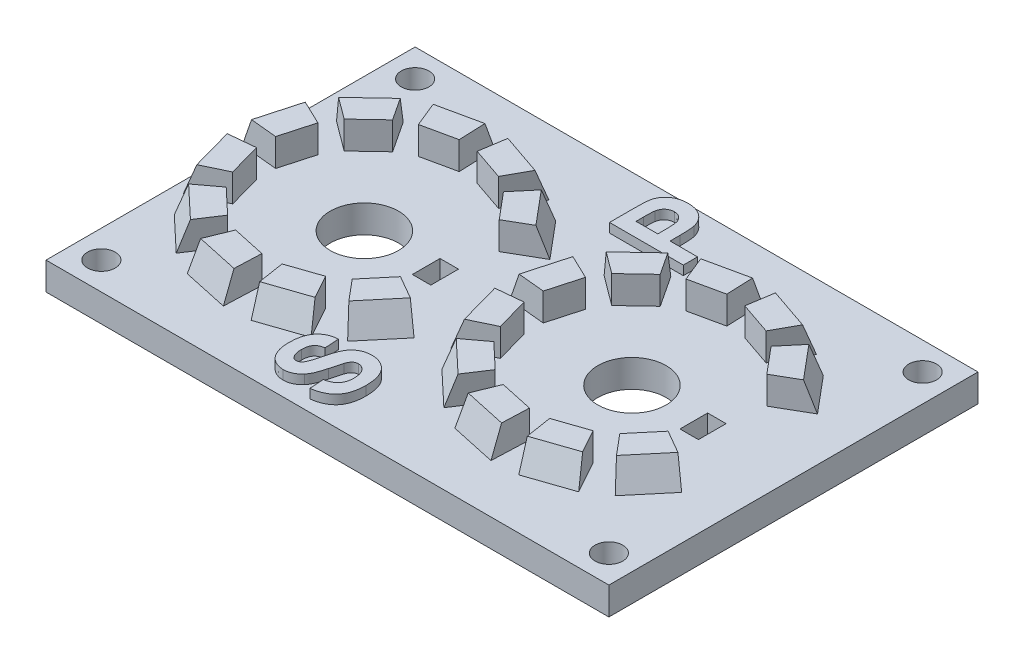
from build123d import *

# Parameters (mm, degrees)
BOSS_EXTRUDE1_DEPTH = 20
SKETCH2_W           = 55
SKETCH2_H           = 34
CUT_EXTRUDE1_DEPTH  = 17
BOSS_EXTRUDE3_REACH = 47
SKETCH7_R           = 1.5
CUT_EXTRUDE4_DEPTH  = 46
SKETCH8_R           = 43.974749051
CUT_EXTRUDE5_DEPTH  = 9
SKETCH10_R          = 55.926551309
CUT_EXTRUDE6_DEPTH  = 17
SKETCH11_R          = 3.7
SKETCH11_W          = 2
SKETCH11_H          = 3
CUT_EXTRUDE7_DEPTH  = 41.422765863
BOSS_EXTRUDE4_DEPTH = 3
CHAMFER1_SIZE       = 1.2
CHAMFER1_SIZE_2     = 3.296972903
BOSS_EXTRUDE5_DEPTH = 1


with BuildPart() as part:
    # Sketch1 → Boss-Extrude1 (new body)
    with BuildSketch(Plane(origin=(0, 0, 0), x_dir=(1, 0, 0), z_dir=(0, 1, 0))):
        with BuildLine():
            Line((35, 20), (35, 7))
            ThreePointArc((35, 7), (28, 0), (35, -7))
            Line((35, -7), (35, -20))
            Line((35, -20), (-35, -20))
            Line((-35, -20), (-35, 20))
            Line((-35, 20), (35, 20))
        make_face()
    extrude(amount=BOSS_EXTRUDE1_DEPTH)

    # Sketch2 → Cut-Extrude1 (cut)
    with BuildSketch(Plane(origin=(0, 20, 0), x_dir=(1, 0, 0), z_dir=(0, 1, 0))):
        with Locations((-4.5, 0)):
            Rectangle(SKETCH2_W, SKETCH2_H)
    extrude(amount=-CUT_EXTRUDE1_DEPTH, mode=Mode.SUBTRACT)

    # Sketch6 → Boss-Extrude3 (add, up to next)
    with BuildSketch(Plane(origin=(0, 20, 0), x_dir=(1, 0, 0), z_dir=(0, 1, 0)), mode=Mode.PRIVATE) as boss_extrude3_sk1:
        with BuildLine():
            Line((-32, -14), (-32, -17))
            Line((-32, -17), (-29, -17))
            ThreePointArc((-29, -17), (-29.878679656, -14.878679656), (-32, -14))
        make_face()
    boss_extrude3_tool1 = extrude(boss_extrude3_sk1.sketch, amount=-BOSS_EXTRUDE3_REACH, mode=Mode.PRIVATE) - part.part
    # Sketch6 → Boss-Extrude3 (add, up to next)
    with BuildSketch(Plane(origin=(0, 20, 0), x_dir=(1, 0, 0), z_dir=(0, 1, 0)), mode=Mode.PRIVATE) as boss_extrude3_sk2:
        with BuildLine():
            Line((23, -14), (23, -17))
            Line((23, -17), (20, -17))
            ThreePointArc((20, -17), (20.878679656, -14.878679656), (23, -14))
        make_face()
    boss_extrude3_tool2 = extrude(boss_extrude3_sk2.sketch, amount=-BOSS_EXTRUDE3_REACH, mode=Mode.PRIVATE) - part.part
    # Sketch6 → Boss-Extrude3 (add, up to next)
    with BuildSketch(Plane(origin=(0, 20, 0), x_dir=(1, 0, 0), z_dir=(0, 1, 0)), mode=Mode.PRIVATE) as boss_extrude3_sk3:
        with BuildLine():
            Line((20, 17), (23, 17))
            Line((23, 17), (23, 14))
            ThreePointArc((23, 14), (20.878679656, 14.878679656), (20, 17))
        make_face()
    boss_extrude3_tool3 = extrude(boss_extrude3_sk3.sketch, amount=-BOSS_EXTRUDE3_REACH, mode=Mode.PRIVATE) - part.part
    # Sketch6 → Boss-Extrude3 (add, up to next)
    with BuildSketch(Plane(origin=(0, 20, 0), x_dir=(1, 0, 0), z_dir=(0, 1, 0)), mode=Mode.PRIVATE) as boss_extrude3_sk4:
        with BuildLine():
            Line((-32, 14), (-32, 17))
            Line((-32, 17), (-29, 17))
            ThreePointArc((-29, 17), (-29.878679656, 14.878679656), (-32, 14))
        make_face()
    boss_extrude3_tool4 = extrude(boss_extrude3_sk4.sketch, amount=-BOSS_EXTRUDE3_REACH, mode=Mode.PRIVATE) - part.part
    add(boss_extrude3_tool1.solids().sort_by_distance((-30.72676, 20, 15.72676))[0])
    add(boss_extrude3_tool2.solids().sort_by_distance((21.72676, 20, 15.72676))[0])
    add(boss_extrude3_tool3.solids().sort_by_distance((21.72676, 20, -15.72676))[0])
    add(boss_extrude3_tool4.solids().sort_by_distance((-30.72676, 20, -15.72676))[0])

    # Sketch7 → Cut-Extrude4 (cut, through all)
    with BuildSketch(Plane(origin=(0, 20, 0), x_dir=(1, 0, 0), z_dir=(0, 1, 0))):
        with Locations(Location((-32, 17, 0), (0, 0, 270))):
            Circle(SKETCH7_R)
        with Locations(Location((23, 17, 0), (0, 0, 270))):
            Circle(SKETCH7_R)
        with Locations(Location((23, -17, 0), (0, 0, 270))):
            Circle(SKETCH7_R)
        with Locations(Location((-32, -17, 0), (0, 0, 270))):
            Circle(SKETCH7_R)
    extrude(amount=-CUT_EXTRUDE4_DEPTH, mode=Mode.SUBTRACT)

    # Sketch8 → Cut-Extrude5 (cut)
    with BuildSketch(Plane(origin=(35, 0, 0), x_dir=(0, 0, -1), z_dir=(1, 0, 0))):
        Circle(SKETCH8_R)
    extrude(amount=-CUT_EXTRUDE5_DEPTH, mode=Mode.SUBTRACT)

    # Sketch10 → Cut-Extrude6 (cut)
    with BuildSketch(Plane(origin=(0, 20, 0), x_dir=(1, 0, 0), z_dir=(0, 1, 0))):
        Circle(SKETCH10_R)
    extrude(amount=-CUT_EXTRUDE6_DEPTH, mode=Mode.SUBTRACT)

    # Sketch11 → Cut-Extrude7 (cut, through all)
    with BuildSketch(Plane(origin=(0, 3, 0), x_dir=(1, 0, 0), z_dir=(0, 1, 0))):
        with Locations(Location((8.5, 0, 0), (0, 0, 270))):
            Circle(SKETCH11_R)
        with Locations(Location((-20.5, 0, 0), (0, 0, 270))):
            Circle(SKETCH11_R)
        with Locations((-12.8, 0)):
            Rectangle(SKETCH11_W, SKETCH11_H)
        with Locations((16.2, 0)):
            Rectangle(SKETCH11_W, SKETCH11_H)
    extrude(amount=-CUT_EXTRUDE7_DEPTH, mode=Mode.SUBTRACT)

    # Sketch13 → Boss-Extrude4 (add)
    with BuildSketch(Plane(origin=(0, 3, 0), x_dir=(1, 0, 0), z_dir=(0, 1, 0))):
        Polygon((20.191342951, -6.75), (17.76647182, -5.35), (15.377827424, -8.196675541), (17.177632731, -10.341599982), align=None)
        Polygon((10.153351083, -10.571491389), (10.586003703, -13.337862968), (15.022020091, -11.820036123), (13.669304812, -9.368473075), align=None)
        Polygon((4.453261518, -9.905246471), (3.394301915, -12.497273585), (7.976532488, -13.489847359), (8.085103528, -10.691953092), align=None)
        Polygon((-0.082718162, -6.389596931), (-2.328663102, -8.061640988), (1.081628796, -11.279085454), (2.620253935, -8.939719582), align=None)
        Polygon((-2.149739915, -1.035876317), (-4.936587743, -1.306946754), (-3.679260235, -5.823711887), (-1.153191445, -4.615830903), align=None)
        Polygon((-1.153191445, 4.615830903), (-3.679260235, 5.823711887), (-4.936587743, 1.306946754), (-2.149739915, 1.035876317), align=None)
        Polygon((2.620253935, 8.939719582), (1.081628796, 11.279085454), (-2.328663102, 8.061640988), (-0.082718162, 6.389596931), align=None)
        Polygon((8.085103528, 10.691953092), (7.976532488, 13.489847359), (3.394301915, 12.497273585), (4.453261518, 9.905246471), align=None)
        Polygon((13.669304812, 9.368473075), (15.022020091, 11.820036123), (10.586003703, 13.337862968), (10.153351083, 10.571491389), align=None)
        Polygon((17.76647182, 5.35), (20.191342951, 6.75), (17.177632731, 10.341599982), (15.377827424, 8.196675541), align=None)
        Polygon((-13.622172576, -8.196675541), (-11.822367269, -10.341599982), (-8.808657049, -6.75), (-11.23352818, -5.35), align=None)
        Polygon((-15.330695188, -9.368473075), (-18.846648917, -10.571491389), (-18.413996297, -13.337862968), (-13.977979909, -11.820036123), align=None)
        Polygon((-20.914896472, -10.691953092), (-24.546738482, -9.905246471), (-25.605698085, -12.497273585), (-21.023467512, -13.489847359), align=None)
        Polygon((-26.379746065, -8.939719582), (-29.082718162, -6.389596931), (-31.328663102, -8.061640988), (-27.918371204, -11.279085454), align=None)
        Polygon((-30.153191445, -4.615830903), (-31.149739915, -1.035876317), (-33.936587743, -1.306946754), (-32.679260235, -5.823711887), align=None)
        Polygon((-31.149739915, 1.035876317), (-30.153191445, 4.615830903), (-32.679260235, 5.823711887), (-33.936587743, 1.306946754), align=None)
        Polygon((-29.082718162, 6.389596931), (-26.379746065, 8.939719582), (-27.918371204, 11.279085454), (-31.328663102, 8.061640988), align=None)
        Polygon((-24.546738482, 9.905246471), (-20.914896472, 10.691953092), (-21.023467512, 13.489847359), (-25.605698085, 12.497273585), align=None)
        Polygon((-18.846648917, 10.571491389), (-15.330695188, 9.368473075), (-13.977979909, 11.820036123), (-18.413996297, 13.337862968), align=None)
        Polygon((-13.622172576, 8.196675541), (-11.23352818, 5.35), (-8.808657049, 6.75), (-11.822367269, 10.341599982), align=None)
    extrude(amount=BOSS_EXTRUDE4_DEPTH)

    # Chamfer1
    # the kernel refuses this chamfer: 3.296972903, 1.2 mm, written as the material it adds along each edge
    with BuildSketch(Plane(origin=(25.689098781, 3, -0.198029738), x_dir=(0.7622780808055234, -0.09904090225205052, -0.6396272564584374), z_dir=(-0.6427876096865381, 0, -0.7660444431189791))) as chamfer1_piece_1_section:
        Polygon((CHAMFER1_SIZE * 0.995083363182, -CHAMFER1_SIZE * 0.0990409022521), (-CHAMFER1_SIZE_2 * 0.0990409022624, -CHAMFER1_SIZE_2 * 0.995083363286), (0, 0), align=None)
    chamfer1_piece_1 = extrude(amount=21.794480275, mode=Mode.PRIVATE)
    chamfer1_piece_1 = split(chamfer1_piece_1, bisect_by=Plane(origin=(20.168043267, 4.0676523, -6.736547921), z_dir=(-0.5000000000000017, 0, -0.8660254037844379)), keep=Keep.TOP, mode=Mode.PRIVATE)
    chamfer1_piece_1 = split(chamfer1_piece_1, bisect_by=Plane(origin=(17.160339072, 4.0676523, -10.320990202), z_dir=(0.7660444431189775, 0, 0.6427876096865401)), keep=Keep.TOP, mode=Mode.PRIVATE)
    chamfer1_piece_1 = split(chamfer1_piece_1, bisect_by=Plane(origin=(18.980208112, 6, -8.793938761), z_dir=(0, -1, 0)), keep=Keep.TOP, mode=Mode.PRIVATE)
    add(chamfer1_piece_1)
    with BuildSketch(Plane(origin=(23.114415568, 3, -9.051143038), x_dir=(0.32214225983948014, -0.09904090225205053, -0.9414962900121342), z_dir=(-0.9461481568757503, 0, -0.3237339420583218))) as chamfer1_piece_2_section:
        Polygon((CHAMFER1_SIZE * 0.995083363182, -CHAMFER1_SIZE * 0.0990409022521), (-CHAMFER1_SIZE_2 * 0.0990409022624, -CHAMFER1_SIZE_2 * 0.995083363286), (0, 0), align=None)
    chamfer1_piece_2 = extrude(amount=21.794480275, mode=Mode.PRIVATE)
    chamfer1_piece_2 = split(chamfer1_piece_2, bisect_by=Plane(origin=(15.009022353, 4.0676523, -11.796479966), z_dir=(-0.87555823130209, 0, -0.48311259929664013)), keep=Keep.TOP, mode=Mode.PRIVATE)
    chamfer1_piece_2 = split(chamfer1_piece_2, bisect_by=Plane(origin=(10.581846505, 4.0676523, -13.311281933), z_dir=(0.987989849476809, 0, 0.15451879280784037)), keep=Keep.TOP, mode=Mode.PRIVATE)
    chamfer1_piece_2 = split(chamfer1_piece_2, bisect_by=Plane(origin=(12.928984658, 6, -12.944196225), z_dir=(0, -1, 0)), keep=Keep.TOP, mode=Mode.PRIVATE)
    add(chamfer1_piece_2)
    with BuildSketch(Plane(origin=(16.335658949, 3, -15.300548406), x_dir=(-0.2106630011766402, -0.09904090225205076, -0.972528662619437), z_dir=(-0.9773338582506358, 0, 0.21170387222940967))) as chamfer1_piece_3_section:
        Polygon((CHAMFER1_SIZE * 0.995083363182, -CHAMFER1_SIZE * 0.0990409022521), (-CHAMFER1_SIZE_2 * 0.0990409022624, -CHAMFER1_SIZE_2 * 0.995083363286), (0, 0), align=None)
    chamfer1_piece_3 = extrude(amount=21.794480275, mode=Mode.PRIVATE)
    chamfer1_piece_3 = split(chamfer1_piece_3, bisect_by=Plane(origin=(7.977575707, 4.0676523, -13.462963434), z_dir=(-0.9992479525042302, 0, 0.03877537125681469)), keep=Keep.TOP, mode=Mode.PRIVATE)
    chamfer1_piece_3 = split(chamfer1_piece_3, bisect_by=Plane(origin=(3.404477063, 4.0676523, -12.472367761), z_dir=(0.9257239692688908, 0, -0.37819985817164176)), keep=Keep.TOP, mode=Mode.PRIVATE)
    chamfer1_piece_3 = split(chamfer1_piece_3, bisect_by=Plane(origin=(5.603692013, 6, -13.370845936), z_dir=(0, -1, 0)), keep=Keep.TOP, mode=Mode.PRIVATE)
    add(chamfer1_piece_3)
    with BuildSketch(Plane(origin=(7.302848089, 3, -17.148503141), x_dir=(-0.6828676369657709, -0.09904090225205052, -0.723797409546265), z_dir=(-0.7273736415730487, 0, 0.6862416378687335))) as chamfer1_piece_4_section:
        Polygon((CHAMFER1_SIZE * 0.995083363182, -CHAMFER1_SIZE * 0.0990409022521), (-CHAMFER1_SIZE_2 * 0.0990409022624, -CHAMFER1_SIZE_2 * 0.995083363286), (0, 0), align=None)
    chamfer1_piece_4 = extrude(amount=21.794480275, mode=Mode.PRIVATE)
    chamfer1_piece_4 = split(chamfer1_piece_4, bisect_by=Plane(origin=(1.096412872, 4.0676523, -11.256607358), z_dir=(-0.8354878114129372, 0, 0.5495089780708051)), keep=Keep.TOP, mode=Mode.PRIVATE)
    chamfer1_piece_4 = split(chamfer1_piece_4, bisect_by=Plane(origin=(-2.307082653, 4.0676523, -8.045574939), z_dir=(0.597158591702786, 0, -0.8021231927550441)), keep=Keep.TOP, mode=Mode.PRIVATE)
    chamfer1_piece_4 = split(chamfer1_piece_4, bisect_by=Plane(origin=(-0.888430716, 6, -9.951155194), z_dir=(0, -1, 0)), keep=Keep.TOP, mode=Mode.PRIVATE)
    add(chamfer1_piece_4)
    with BuildSketch(Plane(origin=(-1.385582629, 3, -14.063413127), x_dir=(-0.9586343338844463, -0.09904090225205059, -0.26685410541909116), z_dir=(-0.2681726127606368, 0, 0.9633708786158806))) as chamfer1_piece_5_section:
        Polygon((CHAMFER1_SIZE * 0.995083363182, -CHAMFER1_SIZE * 0.0990409022521), (-CHAMFER1_SIZE_2 * 0.0990409022624, -CHAMFER1_SIZE_2 * 0.995083363286), (0, 0), align=None)
    chamfer1_piece_5 = extrude(amount=21.794480275, mode=Mode.PRIVATE)
    chamfer1_piece_5 = split(chamfer1_piece_5, bisect_by=Plane(origin=(-3.65498818, 4.0676523, -5.812105808), z_dir=(-0.4313860656812545, 0, 0.9021674247810373)), keep=Keep.TOP, mode=Mode.PRIVATE)
    chamfer1_piece_5 = split(chamfer1_piece_5, bisect_by=Plane(origin=(-4.90980996, 4.0676523, -1.30434214), z_dir=(0.09681087070317776, 0, -0.995302795793166)), keep=Keep.TOP, mode=Mode.PRIVATE)
    chamfer1_piece_5 = split(chamfer1_piece_5, bisect_by=Plane(origin=(-4.679819249, 6, -3.668853442), z_dir=(0, -1, 0)), keep=Keep.TOP, mode=Mode.PRIVATE)
    add(chamfer1_piece_5)
    with BuildSketch(Plane(origin=(-7.230265348, 3, -6.932754485), x_dir=(-0.9586343338844462, -0.09904090225205059, 0.2668541054190925), z_dir=(0.2681726127606381, 0, 0.9633708786158802))) as chamfer1_piece_6_section:
        Polygon((CHAMFER1_SIZE * 0.995083363182, -CHAMFER1_SIZE * 0.0990409022521), (-CHAMFER1_SIZE_2 * 0.0990409022624, -CHAMFER1_SIZE_2 * 0.995083363286), (0, 0), align=None)
    chamfer1_piece_6 = extrude(amount=21.794480275, mode=Mode.PRIVATE)
    chamfer1_piece_6 = split(chamfer1_piece_6, bisect_by=Plane(origin=(-4.90980996, 4.0676523, 1.30434214), z_dir=(0.09681087070317865, 0, 0.9953027957931659)), keep=Keep.TOP, mode=Mode.PRIVATE)
    chamfer1_piece_6 = split(chamfer1_piece_6, bisect_by=Plane(origin=(-3.65498818, 4.0676523, 5.812105808), z_dir=(-0.4313860656812539, 0, -0.9021674247810375)), keep=Keep.TOP, mode=Mode.PRIVATE)
    chamfer1_piece_6 = split(chamfer1_piece_6, bisect_by=Plane(origin=(-4.679819249, 6, 3.668853442), z_dir=(0, -1, 0)), keep=Keep.TOP, mode=Mode.PRIVATE)
    add(chamfer1_piece_6)
    with BuildSketch(Plane(origin=(-8.549882395, 3, 2.192223301), x_dir=(-0.6828676369657699, -0.09904090225205057, 0.723797409546266), z_dir=(0.7273736415730497, 0, 0.6862416378687326))) as chamfer1_piece_7_section:
        Polygon((CHAMFER1_SIZE * 0.995083363182, -CHAMFER1_SIZE * 0.0990409022521), (-CHAMFER1_SIZE_2 * 0.0990409022624, -CHAMFER1_SIZE_2 * 0.995083363286), (0, 0), align=None)
    chamfer1_piece_7 = extrude(amount=21.794480275, mode=Mode.PRIVATE)
    chamfer1_piece_7 = split(chamfer1_piece_7, bisect_by=Plane(origin=(-2.307082653, 4.0676523, 8.045574939), z_dir=(0.5971585917027863, 0, 0.802123192755044)), keep=Keep.TOP, mode=Mode.PRIVATE)
    chamfer1_piece_7 = split(chamfer1_piece_7, bisect_by=Plane(origin=(1.096412872, 4.0676523, 11.256607358), z_dir=(-0.8354878114129369, 0, -0.5495089780708055)), keep=Keep.TOP, mode=Mode.PRIVATE)
    chamfer1_piece_7 = split(chamfer1_piece_7, bisect_by=Plane(origin=(-0.888430716, 6, 9.951155194), z_dir=(0, -1, 0)), keep=Keep.TOP, mode=Mode.PRIVATE)
    add(chamfer1_piece_7)
    with BuildSketch(Plane(origin=(-4.964824547, 3, 10.686572538), x_dir=(-0.21066300117663903, -0.09904090225205053, 0.9725286626194373), z_dir=(0.977333858250636, 0, 0.21170387222940854))) as chamfer1_piece_8_section:
        Polygon((CHAMFER1_SIZE * 0.995083363182, -CHAMFER1_SIZE * 0.0990409022521), (-CHAMFER1_SIZE_2 * 0.0990409022624, -CHAMFER1_SIZE_2 * 0.995083363286), (0, 0), align=None)
    chamfer1_piece_8 = extrude(amount=21.794480275, mode=Mode.PRIVATE)
    chamfer1_piece_8 = split(chamfer1_piece_8, bisect_by=Plane(origin=(3.404477063, 4.0676523, 12.472367761), z_dir=(0.9257239692688906, 0, 0.3781998581716422)), keep=Keep.TOP, mode=Mode.PRIVATE)
    chamfer1_piece_8 = split(chamfer1_piece_8, bisect_by=Plane(origin=(7.977575707, 4.0676523, 13.462963434), z_dir=(-0.9992479525042302, 0, -0.03877537125681596)), keep=Keep.TOP, mode=Mode.PRIVATE)
    chamfer1_piece_8 = split(chamfer1_piece_8, bisect_by=Plane(origin=(5.603692013, 6, 13.370845936), z_dir=(0, -1, 0)), keep=Keep.TOP, mode=Mode.PRIVATE)
    add(chamfer1_piece_8)
    with BuildSketch(Plane(origin=(2.493608225, 3, 16.106756053), x_dir=(0.3221422598394811, -0.0990409022520505, 0.9414962900121339), z_dir=(0.9461481568757498, 0, -0.3237339420583227))) as chamfer1_piece_9_section:
        Polygon((CHAMFER1_SIZE * 0.995083363182, -CHAMFER1_SIZE * 0.0990409022521), (-CHAMFER1_SIZE_2 * 0.0990409022624, -CHAMFER1_SIZE_2 * 0.995083363286), (0, 0), align=None)
    chamfer1_piece_9 = extrude(amount=21.794480275, mode=Mode.PRIVATE)
    chamfer1_piece_9 = split(chamfer1_piece_9, bisect_by=Plane(origin=(10.581846505, 4.0676523, 13.311281933), z_dir=(0.9879898494768089, 0, -0.15451879280784117)), keep=Keep.TOP, mode=Mode.PRIVATE)
    chamfer1_piece_9 = split(chamfer1_piece_9, bisect_by=Plane(origin=(15.009022353, 4.0676523, 11.796479966), z_dir=(-0.8755582313020898, 0, 0.4831125992966406)), keep=Keep.TOP, mode=Mode.PRIVATE)
    chamfer1_piece_9 = split(chamfer1_piece_9, bisect_by=Plane(origin=(12.928984658, 6, 12.944196225), z_dir=(0, -1, 0)), keep=Keep.TOP, mode=Mode.PRIVATE)
    add(chamfer1_piece_9)
    with BuildSketch(Plane(origin=(11.679876901, 3, 16.893570244), x_dir=(0.7622780808055257, -0.09904090225205066, 0.6396272564584348), z_dir=(0.6427876096865355, 0, -0.7660444431189813))) as chamfer1_piece_10_section:
        Polygon((CHAMFER1_SIZE * 0.995083363182, -CHAMFER1_SIZE * 0.0990409022521), (-CHAMFER1_SIZE_2 * 0.0990409022624, -CHAMFER1_SIZE_2 * 0.995083363286), (0, 0), align=None)
    chamfer1_piece_10 = extrude(amount=21.794480275, mode=Mode.PRIVATE)
    chamfer1_piece_10 = split(chamfer1_piece_10, bisect_by=Plane(origin=(20.168043267, 4.0676523, 6.736547921), z_dir=(-0.49999999999999634, 0, 0.8660254037844408)), keep=Keep.TOP, mode=Mode.PRIVATE)
    chamfer1_piece_10 = split(chamfer1_piece_10, bisect_by=Plane(origin=(17.160339072, 4.0676523, 10.320990202), z_dir=(0.7660444431189756, 0, -0.6427876096865424)), keep=Keep.TOP, mode=Mode.PRIVATE)
    chamfer1_piece_10 = split(chamfer1_piece_10, bisect_by=Plane(origin=(18.980208112, 6, 8.793938761), z_dir=(0, -1, 0)), keep=Keep.TOP, mode=Mode.PRIVATE)
    add(chamfer1_piece_10)
    with BuildSketch(Plane(origin=(-3.310901219, 3, -0.198029738), x_dir=(0.7622780808055204, -0.09904090225205057, -0.6396272564584411), z_dir=(-0.6427876096865418, 0, -0.7660444431189761))) as chamfer1_piece_11_section:
        Polygon((CHAMFER1_SIZE * 0.995083363182, -CHAMFER1_SIZE * 0.0990409022521), (-CHAMFER1_SIZE_2 * 0.0990409022624, -CHAMFER1_SIZE_2 * 0.995083363286), (0, 0), align=None)
    chamfer1_piece_11 = extrude(amount=21.794480275, mode=Mode.PRIVATE)
    chamfer1_piece_11 = split(chamfer1_piece_11, bisect_by=Plane(origin=(-8.831956733, 4.0676523, -6.736547921), z_dir=(-0.5000000000000007, 0, -0.8660254037844383)), keep=Keep.TOP, mode=Mode.PRIVATE)
    chamfer1_piece_11 = split(chamfer1_piece_11, bisect_by=Plane(origin=(-11.839660928, 4.0676523, -10.320990202), z_dir=(0.7660444431189806, 0, 0.6427876096865364)), keep=Keep.TOP, mode=Mode.PRIVATE)
    chamfer1_piece_11 = split(chamfer1_piece_11, bisect_by=Plane(origin=(-10.019791888, 6, -8.793938761), z_dir=(0, -1, 0)), keep=Keep.TOP, mode=Mode.PRIVATE)
    add(chamfer1_piece_11)
    with BuildSketch(Plane(origin=(-5.885584432, 3, -9.051143038), x_dir=(0.3221422598394766, -0.09904090225205063, -0.9414962900121354), z_dir=(-0.9461481568757514, 0, -0.32373394205831824))) as chamfer1_piece_12_section:
        Polygon((CHAMFER1_SIZE * 0.995083363182, -CHAMFER1_SIZE * 0.0990409022521), (-CHAMFER1_SIZE_2 * 0.0990409022624, -CHAMFER1_SIZE_2 * 0.995083363286), (0, 0), align=None)
    chamfer1_piece_12 = extrude(amount=21.794480275, mode=Mode.PRIVATE)
    chamfer1_piece_12 = split(chamfer1_piece_12, bisect_by=Plane(origin=(-13.990977647, 4.0676523, -11.796479966), z_dir=(-0.8755582313020934, 0, -0.4831125992966339)), keep=Keep.TOP, mode=Mode.PRIVATE)
    chamfer1_piece_12 = split(chamfer1_piece_12, bisect_by=Plane(origin=(-18.418153495, 4.0676523, -13.311281933), z_dir=(0.9879898494768093, 0, 0.1545187928078383)), keep=Keep.TOP, mode=Mode.PRIVATE)
    chamfer1_piece_12 = split(chamfer1_piece_12, bisect_by=Plane(origin=(-16.071015342, 6, -12.944196225), z_dir=(0, -1, 0)), keep=Keep.TOP, mode=Mode.PRIVATE)
    add(chamfer1_piece_12)
    with BuildSketch(Plane(origin=(-12.664341051, 3, -15.300548406), x_dir=(-0.21066300117664277, -0.09904090225205073, -0.9725286626194363), z_dir=(-0.9773338582506352, 0, 0.2117038722294123))) as chamfer1_piece_13_section:
        Polygon((CHAMFER1_SIZE * 0.995083363182, -CHAMFER1_SIZE * 0.0990409022521), (-CHAMFER1_SIZE_2 * 0.0990409022624, -CHAMFER1_SIZE_2 * 0.995083363286), (0, 0), align=None)
    chamfer1_piece_13 = extrude(amount=21.794480275, mode=Mode.PRIVATE)
    chamfer1_piece_13 = split(chamfer1_piece_13, bisect_by=Plane(origin=(-21.022424293, 4.0676523, -13.462963434), z_dir=(-0.99924795250423, 0, 0.038775371256818444)), keep=Keep.TOP, mode=Mode.PRIVATE)
    chamfer1_piece_13 = split(chamfer1_piece_13, bisect_by=Plane(origin=(-25.595522937, 4.0676523, -12.472367761), z_dir=(0.9257239692688896, 0, -0.37819985817164453)), keep=Keep.TOP, mode=Mode.PRIVATE)
    chamfer1_piece_13 = split(chamfer1_piece_13, bisect_by=Plane(origin=(-23.396307987, 6, -13.370845936), z_dir=(0, -1, 0)), keep=Keep.TOP, mode=Mode.PRIVATE)
    add(chamfer1_piece_13)
    with BuildSketch(Plane(origin=(-21.697151911, 3, -17.148503141), x_dir=(-0.6828676369657719, -0.09904090225205078, -0.7237974095462643), z_dir=(-0.727373641573048, 0, 0.6862416378687345))) as chamfer1_piece_14_section:
        Polygon((CHAMFER1_SIZE * 0.995083363182, -CHAMFER1_SIZE * 0.0990409022521), (-CHAMFER1_SIZE_2 * 0.0990409022624, -CHAMFER1_SIZE_2 * 0.995083363286), (0, 0), align=None)
    chamfer1_piece_14 = extrude(amount=21.794480275, mode=Mode.PRIVATE)
    chamfer1_piece_14 = split(chamfer1_piece_14, bisect_by=Plane(origin=(-27.903587128, 4.0676523, -11.256607358), z_dir=(-0.8354878114129346, 0, 0.5495089780708089)), keep=Keep.TOP, mode=Mode.PRIVATE)
    chamfer1_piece_14 = split(chamfer1_piece_14, bisect_by=Plane(origin=(-31.307082653, 4.0676523, -8.045574939), z_dir=(0.5971585917027841, 0, -0.8021231927550454)), keep=Keep.TOP, mode=Mode.PRIVATE)
    chamfer1_piece_14 = split(chamfer1_piece_14, bisect_by=Plane(origin=(-29.888430716, 6, -9.951155194), z_dir=(0, -1, 0)), keep=Keep.TOP, mode=Mode.PRIVATE)
    add(chamfer1_piece_14)
    with BuildSketch(Plane(origin=(-30.385582629, 3, -14.063413127), x_dir=(-0.9586343338844459, -0.09904090225205042, -0.2668541054190935), z_dir=(-0.2681726127606391, 0, 0.9633708786158799))) as chamfer1_piece_15_section:
        Polygon((CHAMFER1_SIZE * 0.995083363182, -CHAMFER1_SIZE * 0.0990409022521), (-CHAMFER1_SIZE_2 * 0.0990409022624, -CHAMFER1_SIZE_2 * 0.995083363286), (0, 0), align=None)
    chamfer1_piece_15 = extrude(amount=21.794480275, mode=Mode.PRIVATE)
    chamfer1_piece_15 = split(chamfer1_piece_15, bisect_by=Plane(origin=(-35, 4.069218137, -3.671800173), z_dir=(1, 0, 0)), keep=Keep.TOP, mode=Mode.PRIVATE)
    chamfer1_piece_15 = split(chamfer1_piece_15, bisect_by=Plane(origin=(-32.654532581, 4.069218137, -5.811887956), z_dir=(-0.43138606568125154, 0, 0.9021674247810388)), keep=Keep.TOP, mode=Mode.PRIVATE)
    chamfer1_piece_15 = split(chamfer1_piece_15, bisect_by=Plane(origin=(-33.908143552, 4.069218137, -1.304180052), z_dir=(0.09681087070317723, 0, -0.995302795793166)), keep=Keep.TOP, mode=Mode.PRIVATE)
    chamfer1_piece_15 = split(chamfer1_piece_15, bisect_by=Plane(origin=(-33.677850453, 6, -3.671800173), z_dir=(0, -1, 0)), keep=Keep.TOP, mode=Mode.PRIVATE)
    add(chamfer1_piece_15)
    with BuildSketch(Plane(origin=(-36.230265348, 3, -6.932754485), x_dir=(-0.9586343338844457, -0.0990409022520507, 0.2668541054190935), z_dir=(0.2681726127606391, 0, 0.9633708786158799))) as chamfer1_piece_16_section:
        Polygon((CHAMFER1_SIZE * 0.995083363182, -CHAMFER1_SIZE * 0.0990409022521), (-CHAMFER1_SIZE_2 * 0.0990409022624, -CHAMFER1_SIZE_2 * 0.995083363286), (0, 0), align=None)
    chamfer1_piece_16 = extrude(amount=21.794480275, mode=Mode.PRIVATE)
    chamfer1_piece_16 = split(chamfer1_piece_16, bisect_by=Plane(origin=(-35, 4.069218137, 3.671800173), z_dir=(1, 0, 0)), keep=Keep.TOP, mode=Mode.PRIVATE)
    chamfer1_piece_16 = split(chamfer1_piece_16, bisect_by=Plane(origin=(-33.908143552, 4.069218137, 1.304180052), z_dir=(0.09681087070318081, 0, 0.9953027957931657)), keep=Keep.TOP, mode=Mode.PRIVATE)
    chamfer1_piece_16 = split(chamfer1_piece_16, bisect_by=Plane(origin=(-32.654532581, 4.069218137, 5.811887956), z_dir=(-0.4313860656812548, 0, -0.9021674247810371)), keep=Keep.TOP, mode=Mode.PRIVATE)
    chamfer1_piece_16 = split(chamfer1_piece_16, bisect_by=Plane(origin=(-33.677850453, 6, 3.671800173), z_dir=(0, -1, 0)), keep=Keep.TOP, mode=Mode.PRIVATE)
    add(chamfer1_piece_16)
    with BuildSketch(Plane(origin=(-37.549882395, 3, 2.192223301), x_dir=(-0.682867636965771, -0.09904090225205045, 0.7237974095462649), z_dir=(0.7273736415730486, 0, 0.6862416378687337))) as chamfer1_piece_17_section:
        Polygon((CHAMFER1_SIZE * 0.995083363182, -CHAMFER1_SIZE * 0.0990409022521), (-CHAMFER1_SIZE_2 * 0.0990409022624, -CHAMFER1_SIZE_2 * 0.995083363286), (0, 0), align=None)
    chamfer1_piece_17 = extrude(amount=21.794480275, mode=Mode.PRIVATE)
    chamfer1_piece_17 = split(chamfer1_piece_17, bisect_by=Plane(origin=(-31.307082653, 4.0676523, 8.045574939), z_dir=(0.5971585917027884, 0, 0.8021231927550422)), keep=Keep.TOP, mode=Mode.PRIVATE)
    chamfer1_piece_17 = split(chamfer1_piece_17, bisect_by=Plane(origin=(-27.903587128, 4.0676523, 11.256607358), z_dir=(-0.8354878114129358, 0, -0.549508978070807)), keep=Keep.TOP, mode=Mode.PRIVATE)
    chamfer1_piece_17 = split(chamfer1_piece_17, bisect_by=Plane(origin=(-29.888430716, 6, 9.951155194), z_dir=(0, -1, 0)), keep=Keep.TOP, mode=Mode.PRIVATE)
    add(chamfer1_piece_17)
    with BuildSketch(Plane(origin=(-33.964824547, 3, 10.686572538), x_dir=(-0.21066300117664194, -0.0990409022520504, 0.9725286626194366), z_dir=(0.9773338582506353, 0, 0.21170387222941145))) as chamfer1_piece_18_section:
        Polygon((CHAMFER1_SIZE * 0.995083363182, -CHAMFER1_SIZE * 0.0990409022521), (-CHAMFER1_SIZE_2 * 0.0990409022624, -CHAMFER1_SIZE_2 * 0.995083363286), (0, 0), align=None)
    chamfer1_piece_18 = extrude(amount=21.794480275, mode=Mode.PRIVATE)
    chamfer1_piece_18 = split(chamfer1_piece_18, bisect_by=Plane(origin=(-25.595522937, 4.0676523, 12.472367761), z_dir=(0.9257239692688904, 0, 0.37819985817164237)), keep=Keep.TOP, mode=Mode.PRIVATE)
    chamfer1_piece_18 = split(chamfer1_piece_18, bisect_by=Plane(origin=(-21.022424293, 4.0676523, 13.462963434), z_dir=(-0.99924795250423, 0, -0.0387753712568171)), keep=Keep.TOP, mode=Mode.PRIVATE)
    chamfer1_piece_18 = split(chamfer1_piece_18, bisect_by=Plane(origin=(-23.396307987, 6, 13.370845936), z_dir=(0, -1, 0)), keep=Keep.TOP, mode=Mode.PRIVATE)
    add(chamfer1_piece_18)
    with BuildSketch(Plane(origin=(-26.506391775, 3, 16.106756053), x_dir=(0.32214225983947853, -0.09904090225205063, 0.9414962900121346), z_dir=(0.9461481568757508, 0, -0.3237339420583202))) as chamfer1_piece_19_section:
        Polygon((CHAMFER1_SIZE * 0.995083363182, -CHAMFER1_SIZE * 0.0990409022521), (-CHAMFER1_SIZE_2 * 0.0990409022624, -CHAMFER1_SIZE_2 * 0.995083363286), (0, 0), align=None)
    chamfer1_piece_19 = extrude(amount=21.794480275, mode=Mode.PRIVATE)
    chamfer1_piece_19 = split(chamfer1_piece_19, bisect_by=Plane(origin=(-18.418153495, 4.0676523, 13.311281933), z_dir=(0.9879898494768087, 0, -0.15451879280784223)), keep=Keep.TOP, mode=Mode.PRIVATE)
    chamfer1_piece_19 = split(chamfer1_piece_19, bisect_by=Plane(origin=(-13.990977647, 4.0676523, 11.796479966), z_dir=(-0.8755582313020916, 0, 0.4831125992966371)), keep=Keep.TOP, mode=Mode.PRIVATE)
    chamfer1_piece_19 = split(chamfer1_piece_19, bisect_by=Plane(origin=(-16.071015342, 6, 12.944196225), z_dir=(0, -1, 0)), keep=Keep.TOP, mode=Mode.PRIVATE)
    add(chamfer1_piece_19)
    with BuildSketch(Plane(origin=(-17.320123099, 3, 16.893570244), x_dir=(0.7622780808055211, -0.09904090225205044, 0.6396272564584401), z_dir=(0.6427876096865408, 0, -0.7660444431189768))) as chamfer1_piece_20_section:
        Polygon((CHAMFER1_SIZE * 0.995083363182, -CHAMFER1_SIZE * 0.0990409022521), (-CHAMFER1_SIZE_2 * 0.0990409022624, -CHAMFER1_SIZE_2 * 0.995083363286), (0, 0), align=None)
    chamfer1_piece_20 = extrude(amount=21.794480275, mode=Mode.PRIVATE)
    chamfer1_piece_20 = split(chamfer1_piece_20, bisect_by=Plane(origin=(-11.839660928, 4.0676523, 10.320990202), z_dir=(0.766044443118979, 0, -0.6427876096865383)), keep=Keep.TOP, mode=Mode.PRIVATE)
    chamfer1_piece_20 = split(chamfer1_piece_20, bisect_by=Plane(origin=(-8.831956733, 4.0676523, 6.736547921), z_dir=(-0.5000000000000009, 0, 0.8660254037844382)), keep=Keep.TOP, mode=Mode.PRIVATE)
    chamfer1_piece_20 = split(chamfer1_piece_20, bisect_by=Plane(origin=(-10.019791888, 6, 8.793938761), z_dir=(0, -1, 0)), keep=Keep.TOP, mode=Mode.PRIVATE)
    add(chamfer1_piece_20)

    # Sketch14 → Boss-Extrude5 (add)
    # profile 1 of 2: a face of its own
    with BuildSketch(Plane(origin=(0, 3, 0), x_dir=(1, 0, 0), z_dir=(0, 1, 0))):
        with BuildLine():
            Line((-7.666666667, -18.728205128), (-7.769230769, -17.18974359))
            add(Edge.make_bspline(
                [(-7.769230769, -17.18974359), (-7.704867103, -17.177486922), (-7.579844775, -17.153679124), (-7.401668474, -17.100785914), (-7.235566544, -17.042553758), (-7.083279676, -16.973003534), (-6.942134716, -16.896725985), (-6.815991021, -16.808309077), (-6.702194678, -16.711633646), (-6.602462471, -16.604632278), (-6.513001422, -16.489009879), (-6.438606397, -16.361623051), (-6.373844847, -16.226151759), (-6.320651789, -16.08144581), (-6.280907503, -15.926163237), (-6.25264151, -15.761614993), (-6.23453818, -15.587576974), (-6.232046112, -15.468635372), (-6.230769231, -15.407692308)],
                knots=[0, 0, 0, 0, 1.204677245, 2.340008924, 3.41562088, 4.44046575, 5.417001248, 6.3630415, 7.269134822, 8.159094629, 9.049542694, 9.952967105, 10.867337362, 11.809438639, 12.784390299, 13.812011701, 14.878922867, 16, 16, 16, 16], degree=3))
            add(Edge.make_bspline(
                [(-6.230769231, -15.407692308), (-6.231474743, -15.343547835), (-6.232847, -15.218783531), (-6.249656318, -15.037954691), (-6.274117139, -14.868986387), (-6.311537011, -14.712699609), (-6.357503387, -14.568314826), (-6.413240008, -14.435689697), (-6.481146939, -14.315833941), (-6.559538174, -14.209080815), (-6.644483701, -14.115289608), (-6.731788128, -14.032075981), (-6.822400096, -13.96109412), (-6.918773454, -13.904683461), (-7.017186329, -13.859122516), (-7.120449998, -13.828989483), (-7.226225383, -13.808638258), (-7.298514503, -13.806304182), (-7.334935897, -13.805128205)],
                knots=[0, 0, 0, 0, 1.418030258, 2.758141892, 4.012849053, 5.190504034, 6.307525772, 7.360759663, 8.365925826, 9.346494891, 10.283396317, 11.160841652, 12.011476082, 12.821866951, 13.625513811, 14.402856512, 15.195311921, 16, 16, 16, 16], degree=3))
            add(Edge.make_bspline(
                [(-7.334935897, -13.805128205), (-7.380564553, -13.806577196), (-7.469830341, -13.809411934), (-7.59752156, -13.843280642), (-7.715935925, -13.894745085), (-7.824238928, -13.970447805), (-7.922388679, -14.07370335), (-8.011990198, -14.20614574), (-8.094791553, -14.369087799), (-8.140655091, -14.490507491), (-8.165064103, -14.555128205)],
                knots=[0, 0, 0, 0, 0.904653283, 1.769821757, 2.60630992, 3.46039906, 4.376381456, 5.421829955, 6.627873392, 8, 8, 8, 8], degree=3))
            add(Edge.make_bspline(
                [(-8.165064103, -14.555128205), (-8.17435117, -14.58284214), (-8.195134118, -14.644861425), (-8.224851775, -14.750659739), (-8.261961232, -14.878096621), (-8.304142054, -15.029013611), (-8.347281931, -15.203359965), (-8.400425365, -15.399188463), (-8.453307426, -15.618886471), (-8.492344951, -15.772587462), (-8.512820513, -15.853205128)],
                knots=[0, 0, 0, 0, 0.521821638, 1.167752076, 1.961721917, 2.891982557, 3.96540661, 5.168436773, 6.514817513, 8, 8, 8, 8], degree=3))
            add(Edge.make_bspline(
                [(-8.512820513, -15.853205128), (-8.539053999, -15.95818486), (-8.589667219, -16.160726084), (-8.679361437, -16.449731767), (-8.769615877, -16.715238322), (-8.863523534, -16.957233), (-8.964415872, -17.173944301), (-9.069775285, -17.366169565), (-9.178271337, -17.53557312), (-9.259228833, -17.634337774), (-9.298076923, -17.681730769)],
                knots=[0, 0, 0, 0, 1.293827876, 2.496229314, 3.617486305, 4.647214227, 5.598941135, 6.473853732, 7.267666729, 8, 8, 8, 8], degree=3))
            add(Edge.make_bspline(
                [(-9.298076923, -17.681730769), (-9.353101553, -17.740499201), (-9.460982428, -17.855720146), (-9.638251411, -18.007390637), (-9.825507729, -18.134835149), (-10.02136918, -18.239735935), (-10.226963331, -18.320507556), (-10.44091402, -18.377757443), (-10.663779634, -18.414811649), (-10.815556398, -18.418592775), (-10.892628205, -18.420512821)],
                knots=[0, 0, 0, 0, 1.064429417, 2.086912298, 3.078678339, 4.055528992, 5.020032834, 5.993708893, 6.981211098, 8, 8, 8, 8], degree=3))
            add(Edge.make_bspline(
                [(-10.892628205, -18.420512821), (-10.99180033, -18.416666504), (-11.189574911, -18.408995966), (-11.480145441, -18.342014937), (-11.760621378, -18.234468764), (-11.984057849, -18.112882181), (-12.152905641, -17.994373779), (-12.273871019, -17.896355371), (-12.387062674, -17.788627158), (-12.489746546, -17.66976723), (-12.587930015, -17.544174772), (-12.6751185, -17.406987807), (-12.757245117, -17.262094934), (-12.85460244, -17.052418528), (-12.95605832, -16.767735472), (-13.041579193, -16.397347536), (-13.092988282, -15.994068413), (-13.09929509, -15.714473757), (-13.102564103, -15.569551282)],
                knots=[0, 0, 0, 0, 1.173854899, 2.340966893, 3.512960251, 4.725330002, 5.343426374, 5.955334136, 6.568647945, 7.192068799, 7.814943173, 8.455761621, 9.116040544, 9.787122478, 11.192596942, 12.687979905, 14.283278534, 16, 16, 16, 16], degree=3))
            add(Edge.make_bspline(
                [(-13.102564103, -15.569551282), (-13.100977285, -15.450888637), (-13.09789096, -15.220092329), (-13.066681547, -14.885526272), (-13.018107787, -14.573023422), (-12.94838038, -14.283680388), (-12.856252174, -14.017362357), (-12.746510062, -13.773037003), (-12.616218637, -13.550911942), (-12.464630204, -13.353691329), (-12.297513679, -13.177986665), (-12.114973931, -13.024712446), (-11.919316326, -12.893282674), (-11.710683848, -12.782849117), (-11.488003823, -12.696125936), (-11.25155411, -12.632431183), (-11.001891254, -12.590302921), (-10.83081977, -12.579743344), (-10.743589744, -12.574358974)],
                knots=[0, 0, 0, 0, 1.325124071, 2.577337985, 3.749592149, 4.855247722, 5.896868755, 6.892903601, 7.842551483, 8.766257401, 9.665194363, 10.546067736, 11.423174165, 12.293291263, 13.177512979, 14.086532529, 15.024315359, 16, 16, 16, 16], degree=3))
            Line((-10.743589744, -12.574358974), (-10.641025641, -14.112820513))
            add(Edge.make_bspline(
                [(-10.641025641, -14.112820513), (-10.689269314, -14.121692714), (-10.783291216, -14.138983711), (-10.917922372, -14.176629501), (-11.042540987, -14.21891419), (-11.157121191, -14.269206952), (-11.260317961, -14.32765174), (-11.352728578, -14.394387874), (-11.435430098, -14.466818626), (-11.508291419, -14.546977812), (-11.56979019, -14.637765311), (-11.624571609, -14.736560514), (-11.669238198, -14.847086703), (-11.706037135, -14.96777638), (-11.734276647, -15.099165318), (-11.755491462, -15.240422984), (-11.765788262, -15.392050639), (-11.768056997, -15.496356141), (-11.769230769, -15.550320513)],
                knots=[0, 0, 0, 0, 1.150855866, 2.242898388, 3.27787599, 4.237823789, 5.175651342, 6.056061848, 6.908895975, 7.75236871, 8.590605917, 9.477244771, 10.399349179, 11.382998967, 12.435674925, 13.55107929, 14.733005797, 16, 16, 16, 16], degree=3))
            add(Edge.make_bspline(
                [(-11.769230769, -15.550320513), (-11.768196012, -15.606429531), (-11.766182847, -15.715592134), (-11.753828344, -15.874671141), (-11.731023122, -16.023899185), (-11.70133638, -16.164009168), (-11.660949621, -16.294813934), (-11.611704584, -16.416037447), (-11.553728015, -16.528234312), (-11.508114053, -16.596647069), (-11.485576923, -16.630448718)],
                knots=[0, 0, 0, 0, 1.186678824, 2.308736671, 3.37120409, 4.377216403, 5.334874112, 6.262130804, 7.141346615, 8, 8, 8, 8], degree=3))
            add(Edge.make_bspline(
                [(-11.485576923, -16.630448718), (-11.454790564, -16.669131867), (-11.395166941, -16.744049121), (-11.2767747, -16.824675938), (-11.143054213, -16.873213469), (-11.048491371, -16.879055511), (-11, -16.882051282)],
                knots=[0, 0, 0, 0, 1.037857257, 2.010007357, 2.979541333, 4, 4, 4, 4], degree=3))
            add(Edge.make_bspline(
                [(-11, -16.882051282), (-10.954681594, -16.879601287), (-10.865411547, -16.874775188), (-10.738601512, -16.826097757), (-10.621102893, -16.751238499), (-10.557276104, -16.681294802), (-10.524038462, -16.644871795)],
                knots=[0, 0, 0, 0, 0.98538058, 1.941042925, 2.927803204, 4, 4, 4, 4], degree=3))
            add(Edge.make_bspline(
                [(-10.524038462, -16.644871795), (-10.501858172, -16.616022909), (-10.452529335, -16.55186315), (-10.391217359, -16.433338056), (-10.326985673, -16.2898209), (-10.261933141, -16.119430459), (-10.194993472, -15.922783431), (-10.127497572, -15.69885927), (-10.061369719, -15.447781545), (-9.994325639, -15.177139705), (-9.929294933, -14.901978833), (-9.857931675, -14.639463731), (-9.788418224, -14.395347066), (-9.715541481, -14.170780913), (-9.644599601, -13.964602937), (-9.571736563, -13.777815387), (-9.500775516, -13.609136927), (-9.403202443, -13.412434396), (-9.271014304, -13.189521778), (-9.07895425, -12.955755158), (-8.863040643, -12.749783036), (-8.66061982, -12.604822557), (-8.485715361, -12.506363849), (-8.345759936, -12.442212031), (-8.197835634, -12.38786075), (-8.042680174, -12.342602406), (-7.879992694, -12.310174322), (-7.710700163, -12.283254672), (-7.533350299, -12.269517621), (-7.412412126, -12.267627213), (-7.350961538, -12.266666667)],
                knots=[0, 0, 0, 0, 0.516255311, 1.148148894, 1.888861859, 2.751620851, 3.738268431, 4.840557414, 6.07428004, 7.42751106, 8.802854092, 10.091833706, 11.293062756, 12.409377658, 13.44651028, 14.39102378, 15.258213098, 16.045831186, 17.510454751, 18.929597364, 20.331088364, 21.740370042, 22.45410143, 23.180993031, 23.925547029, 24.691954406, 25.475059937, 26.281333581, 27.126718562, 28, 28, 28, 28], degree=3))
            add(Edge.make_bspline(
                [(-7.350961538, -12.266666667), (-7.294290073, -12.267986532), (-7.181746034, -12.270607656), (-7.014704747, -12.288934595), (-6.850620032, -12.317250021), (-6.689332694, -12.35926531), (-6.531451468, -12.414477643), (-6.374869084, -12.477924714), (-6.221993929, -12.555791993), (-6.072895342, -12.645014213), (-5.928027911, -12.743382114), (-5.794201823, -12.854702359), (-5.667633148, -12.973439567), (-5.552434236, -13.103735144), (-5.446641891, -13.244067339), (-5.348220624, -13.392588724), (-5.261987497, -13.552323037), (-5.184780924, -13.72093387), (-5.117722058, -13.900043353), (-5.057972359, -14.089205298), (-5.009088525, -14.290184119), (-4.967183992, -14.501286889), (-4.935317963, -14.723291019), (-4.913067722, -14.955917569), (-4.900520011, -15.199219818), (-4.898476708, -15.364943285), (-4.897435897, -15.449358974)],
                knots=[0, 0, 0, 0, 0.900673708, 1.788650733, 2.668102459, 3.545420189, 4.434208745, 5.325103822, 6.228854033, 7.15789738, 8.085853671, 9.00886332, 9.921780837, 10.841974279, 11.769192201, 12.713551961, 13.671065578, 14.651348434, 15.659047947, 16.709071323, 17.802583073, 18.944913937, 20.128896835, 21.365799559, 22.658199399, 24, 24, 24, 24], degree=3))
            add(Edge.make_bspline(
                [(-4.897435897, -15.449358974), (-4.899429717, -15.571240913), (-4.903311731, -15.808547939), (-4.937938191, -16.153333888), (-4.991203627, -16.476641454), (-5.067643196, -16.778476208), (-5.168865588, -17.057778167), (-5.290705565, -17.315674739), (-5.433873511, -17.55253006), (-5.601722154, -17.766164606), (-5.790092563, -17.959195738), (-5.998177695, -18.132123164), (-6.226947062, -18.282868354), (-6.475744784, -18.413213962), (-6.744681086, -18.523575586), (-7.033349283, -18.615113602), (-7.342974743, -18.683937893), (-7.556903276, -18.713194183), (-7.666666667, -18.728205128)],
                knots=[0, 0, 0, 0, 1.218139507, 2.37174651, 3.460374984, 4.491365737, 5.47959152, 6.425515823, 7.338627716, 8.240236466, 9.135242029, 10.030263523, 10.939666966, 11.868877268, 12.833814776, 13.842095051, 14.892812657, 16, 16, 16, 16], degree=3))
        make_face()
    # profile 2 of 2: a face of its own
    with BuildSketch(Plane(origin=(0, 3, 0), x_dir=(1, 0, 0), z_dir=(0, 1, 0))):
        with BuildLine():
            Line((1, 13.066666667), (-7, 13.066666667))
            Line((-7, 13.066666667), (-7, 15.625961538))
            add(Edge.make_bspline(
                [(-7, 15.625961538), (-6.999873407, 15.741884131), (-6.999631283, 15.96359987), (-6.992904062, 16.279863961), (-6.983380939, 16.564612393), (-6.971520293, 16.817422555), (-6.953821931, 17.039184018), (-6.933327494, 17.228901985), (-6.911280918, 17.387771099), (-6.888465661, 17.481324414), (-6.878205128, 17.523397436)],
                knots=[0, 0, 0, 0, 1.460485487, 2.793352117, 3.985295279, 5.050041172, 5.981765236, 6.787433016, 7.454681457, 8, 8, 8, 8], degree=3))
            add(Edge.make_bspline(
                [(-6.878205128, 17.523397436), (-6.862254698, 17.579345989), (-6.830596832, 17.69039076), (-6.763065945, 17.849454071), (-6.684960163, 18.002882319), (-6.591443245, 18.147916104), (-6.486819694, 18.28747426), (-6.367476302, 18.418553479), (-6.235541416, 18.544308853), (-6.090620378, 18.662026485), (-5.933536488, 18.77050432), (-5.763348329, 18.86281774), (-5.582453035, 18.941478015), (-5.391583188, 19.007953482), (-5.188567302, 19.057095536), (-4.974730988, 19.09146), (-4.750004663, 19.115389274), (-4.596219343, 19.117083098), (-4.517628205, 19.117948718)],
                knots=[0, 0, 0, 0, 0.90701795, 1.800218131, 2.691237491, 3.590755324, 4.489345738, 5.410049561, 6.353416583, 7.331108218, 8.320667363, 9.327869084, 10.346901479, 11.396069477, 12.477683694, 13.601391361, 14.774204313, 16, 16, 16, 16], degree=3))
            add(Edge.make_bspline(
                [(-4.517628205, 19.117948718), (-4.398276526, 19.115482907), (-4.168517991, 19.110736086), (-3.83916709, 19.057510459), (-3.53819717, 18.976550498), (-3.268668624, 18.857282149), (-3.028359778, 18.714485562), (-2.814187839, 18.552875806), (-2.626837966, 18.373512225), (-2.470458644, 18.175254922), (-2.340446002, 17.968410838), (-2.230041068, 17.760340907), (-2.145023351, 17.549231773), (-2.107999028, 17.405275049), (-2.08974359, 17.334294872)],
                knots=[0, 0, 0, 0, 1.312287291, 2.526225091, 3.66160774, 4.733064323, 5.758420094, 6.731958832, 7.679884997, 8.604426126, 9.503035055, 10.365515642, 11.194091208, 12, 12, 12, 12], degree=3))
            add(Edge.make_bspline(
                [(-2.08974359, 17.334294872), (-2.080295133, 17.283609286), (-2.060365644, 17.176698941), (-2.036802456, 17.007760458), (-2.017995377, 16.822217031), (-2.002101708, 16.620767594), (-1.989563072, 16.402766146), (-1.979571631, 16.168780758), (-1.975340028, 15.918712693), (-1.974692676, 15.746688788), (-1.974358974, 15.658012821)],
                knots=[0, 0, 0, 0, 0.735324052, 1.55100799, 2.431975956, 3.395016742, 4.433022208, 5.546367649, 6.73518612, 8, 8, 8, 8], degree=3))
            Line((-1.974358974, 15.658012821), (-1.974358974, 14.605128205))
            Line((-1.974358974, 14.605128205), (1, 14.605128205))
            Line((1, 14.605128205), (1, 13.066666667))
        make_face()
        with BuildLine():
            Line((-5.666666667, 14.605128205), (-3.307692308, 14.605128205))
            Line((-3.307692308, 14.605128205), (-3.307692308, 15.528205128))
            add(Edge.make_bspline(
                [(-3.307692308, 15.528205128), (-3.307880959, 15.607801029), (-3.308241872, 15.760078002), (-3.314207089, 15.978670132), (-3.326511339, 16.176222579), (-3.337322595, 16.353960665), (-3.357209915, 16.509914888), (-3.378762154, 16.64601981), (-3.405558931, 16.761188169), (-3.445259188, 16.886126491), (-3.50833731, 17.02041773), (-3.601798106, 17.163345762), (-3.71485439, 17.287790995), (-3.845467902, 17.392152773), (-3.989935358, 17.476370589), (-4.148174328, 17.535569589), (-4.3170533, 17.57419541), (-4.434078818, 17.577703309), (-4.493589744, 17.579487179)],
                knots=[0, 0, 0, 0, 1.412060058, 2.701448551, 3.878430238, 4.923620429, 5.859273569, 6.666296764, 7.367380421, 7.954782933, 8.989306978, 9.988098977, 10.974267863, 11.958476852, 12.943506738, 13.927350664, 14.945996704, 16, 16, 16, 16], degree=3))
            add(Edge.make_bspline(
                [(-4.493589744, 17.579487179), (-4.566070173, 17.576968497), (-4.706600168, 17.572085105), (-4.906721219, 17.518212588), (-5.088397944, 17.435138439), (-5.245671567, 17.316204412), (-5.378588164, 17.173324531), (-5.486162502, 17.010521619), (-5.566031066, 16.829368994), (-5.595574579, 16.699780201), (-5.610576923, 16.633974359)],
                knots=[0, 0, 0, 0, 1.086074845, 2.105755921, 3.089189434, 4.069607478, 5.045979424, 6.007269565, 6.988081457, 8, 8, 8, 8], degree=3))
            add(Edge.make_bspline(
                [(-5.610576923, 16.633974359), (-5.615099815, 16.605696006), (-5.625139233, 16.54292683), (-5.635616614, 16.438591686), (-5.645145782, 16.315163194), (-5.652969513, 16.172492572), (-5.659085859, 16.011145333), (-5.664445287, 15.83058928), (-5.664875846, 15.631299941), (-5.666053187, 15.491879037), (-5.666666667, 15.419230769)],
                knots=[0, 0, 0, 0, 0.564603001, 1.253243608, 2.066786758, 3.005752288, 4.070476343, 5.250658742, 6.567396469, 8, 8, 8, 8], degree=3))
            Line((-5.666666667, 15.419230769), (-5.666666667, 14.605128205))
        make_face(mode=Mode.SUBTRACT)
    extrude(amount=BOSS_EXTRUDE5_DEPTH)


solid = part.part
